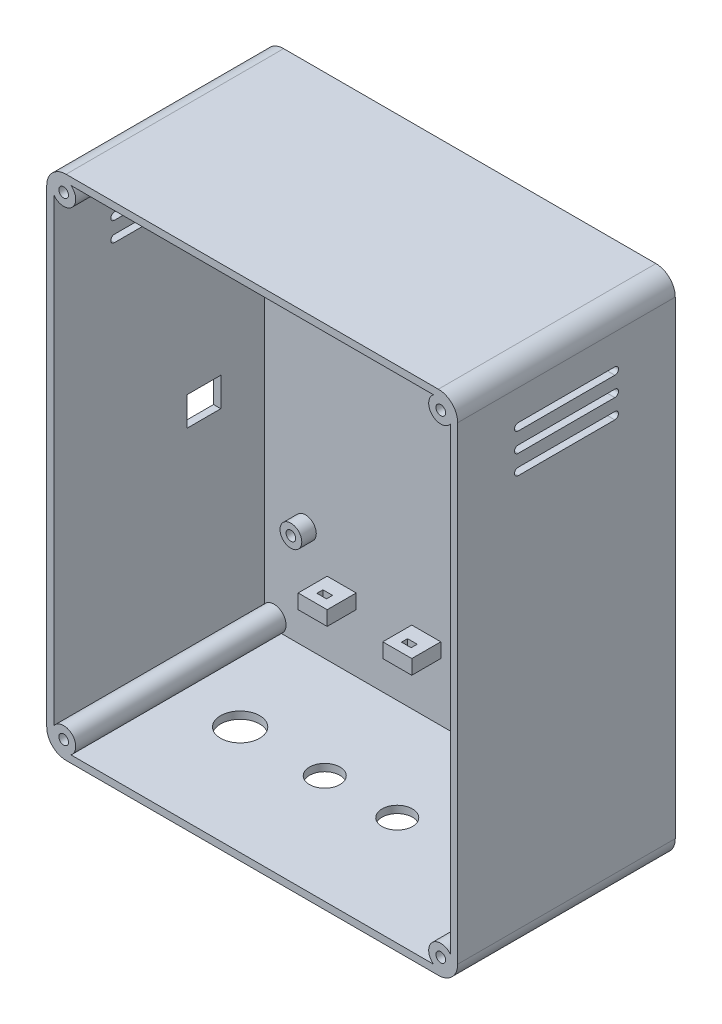
from build123d import *

# Parameters (mm, degrees)
BLOCK_DEPTH                    = 90
SHELL1_T                       = -3
SKETCH2_R                      = 5
CORNER_COLUMNS_DEPTH           = 90
SKETCH3_R                      = 2
FRONT_PANEL_INSERT_HOLES_DEPTH = 7
SKETCH4_R                      = 4.5
PLATE_BOSSES_DEPTH             = 6
SKETCH5_R                      = 2
PLATE_INSERT_HOLES_DEPTH       = 7
SKETCH6_R                      = 8.1
SKETCH6_R_2                    = 6.3
CABLE_GLAND_HOLES_DEPTH        = 4
SKETCH7_W                      = 12
SKETCH7_H                      = 6
CABLE_TIE_BARS_DEPTH           = 12
SKETCH8_W                      = 4
SKETCH8_H                      = 2.5
CABLE_TIE_SLOTS_DEPTH          = 6.02
SKETCH9_W                      = 14
SKETCH9_H                      = 12
USB_ACCESS_DEPTH               = 4
VENTS_LEFT_DEPTH               = 4
VENTS_START                    = -4
VENTS_RIGHT_DEPTH              = 4
SKETCH12_R                     = 4.75
KEYHOLE_HEADS_DEPTH            = 4
KEYHOLE_SLOTS_DEPTH            = 4


with BuildPart() as part:
    # Sketch1 → Block (new body)
    with BuildSketch(Plane.XY):
        with BuildLine():
            Line((-77, 0), (77, 0))
            ThreePointArc((77, 0), (82.656854249, 2.343145751), (85, 8))
            Line((85, 8), (85, 202))
            ThreePointArc((85, 202), (82.656854249, 207.656854249), (77, 210))
            Line((77, 210), (-77, 210))
            ThreePointArc((-77, 210), (-82.656854249, 207.656854249), (-85, 202))
            Line((-85, 202), (-85, 8))
            ThreePointArc((-85, 8), (-82.656854249, 2.343145751), (-77, 0))
        make_face()
    extrude(amount=BLOCK_DEPTH)

    # Shell1
    shell1_openings = [part.faces().sort_by_distance(p)[0] for p in [
        (0, 105, 90),
    ]]
    offset(amount=SHELL1_T, openings=shell1_openings, kind=Kind.INTERSECTION)

    # Sketch2 → Corner columns (add)
    with BuildSketch(Plane.XY):
        with Locations((-78, 7)):
            Circle(SKETCH2_R)
        with Locations((78, 7)):
            Circle(SKETCH2_R)
        with Locations((-78, 203)):
            Circle(SKETCH2_R)
        with Locations((78, 203)):
            Circle(SKETCH2_R)
    extrude(amount=CORNER_COLUMNS_DEPTH)

    # Sketch3 → Front panel insert holes (cut)
    with BuildSketch(Plane.XY.offset(90)):
        with Locations((-78, 7)):
            Circle(SKETCH3_R)
        with Locations((78, 7)):
            Circle(SKETCH3_R)
        with Locations((-78, 203)):
            Circle(SKETCH3_R)
        with Locations((78, 203)):
            Circle(SKETCH3_R)
    extrude(amount=-FRONT_PANEL_INSERT_HOLES_DEPTH, mode=Mode.SUBTRACT)

    # Sketch4 → Plate bosses (add)
    with BuildSketch(Plane.XY.offset(3)):
        with Locations((-65, 46)):
            Circle(SKETCH4_R)
        with Locations((65, 46)):
            Circle(SKETCH4_R)
        with Locations((-65, 190)):
            Circle(SKETCH4_R)
        with Locations((65, 190)):
            Circle(SKETCH4_R)
    extrude(amount=PLATE_BOSSES_DEPTH)

    # Sketch5 → Plate insert holes (cut)
    with BuildSketch(Plane.XY.offset(9)):
        with Locations((-65, 46)):
            Circle(SKETCH5_R)
        with Locations((65, 46)):
            Circle(SKETCH5_R)
        with Locations((-65, 190)):
            Circle(SKETCH5_R)
        with Locations((65, 190)):
            Circle(SKETCH5_R)
    extrude(amount=-PLATE_INSERT_HOLES_DEPTH, mode=Mode.SUBTRACT)

    # Sketch6 → Cable gland holes (cut)
    with BuildSketch(Plane(origin=(0, 0, 0), x_dir=(1, 0, 0), z_dir=(0, 1, 0))):
        with Locations((-50, -45)):
            Circle(SKETCH6_R)
        with Locations((-15, -45)):
            Circle(SKETCH6_R_2)
        with Locations((15, -45)):
            Circle(SKETCH6_R_2)
        with Locations((50, -45)):
            Circle(SKETCH6_R_2)
    extrude(amount=CABLE_GLAND_HOLES_DEPTH, mode=Mode.SUBTRACT)

    # Sketch7 → Cable tie bars (add)
    with BuildSketch(Plane.XY.offset(3)):
        with Locations((-50, 30)):
            Rectangle(SKETCH7_W, SKETCH7_H)
        with Locations((-15, 30)):
            Rectangle(SKETCH7_W, SKETCH7_H)
        with Locations((15, 30)):
            Rectangle(SKETCH7_W, SKETCH7_H)
        with Locations((50, 30)):
            Rectangle(SKETCH7_W, SKETCH7_H)
    extrude(amount=CABLE_TIE_BARS_DEPTH)

    # Sketch8 → Cable tie slots (cut)
    with BuildSketch(Plane(origin=(0, 26.99, 0), x_dir=(1, 0, 0), z_dir=(0, 1, 0))):
        with Locations((-50, -10)):
            Rectangle(SKETCH8_W, SKETCH8_H)
        with Locations((-15, -10)):
            Rectangle(SKETCH8_W, SKETCH8_H)
        with Locations((15, -10)):
            Rectangle(SKETCH8_W, SKETCH8_H)
        with Locations((50, -10)):
            Rectangle(SKETCH8_W, SKETCH8_H)
    extrude(amount=CABLE_TIE_SLOTS_DEPTH, mode=Mode.SUBTRACT)

    # Sketch9 → USB access (cut)
    with BuildSketch(Plane(origin=(-85, 0, 0), x_dir=(0, 0, -1), z_dir=(1, 0, 0))):
        with Locations((-28, 95)):
            Rectangle(SKETCH9_W, SKETCH9_H)
    extrude(amount=USB_ACCESS_DEPTH, mode=Mode.SUBTRACT)

    # Sketch10 → Vents left (cut)
    with BuildSketch(Plane(origin=(-85, 0, 0), x_dir=(0, 0, -1), z_dir=(1, 0, 0))):
        with BuildLine():
            Line((-25, 170.5), (-65, 170.5))
            ThreePointArc((-65, 170.5), (-66.5, 172), (-65, 173.5))
            Line((-65, 173.5), (-25, 173.5))
            ThreePointArc((-25, 173.5), (-23.5, 172), (-25, 170.5))
        make_face()
        with BuildLine():
            Line((-25, 178.5), (-65, 178.5))
            ThreePointArc((-65, 178.5), (-66.5, 180), (-65, 181.5))
            Line((-65, 181.5), (-25, 181.5))
            ThreePointArc((-25, 181.5), (-23.5, 180), (-25, 178.5))
        make_face()
        with BuildLine():
            Line((-25, 186.5), (-65, 186.5))
            ThreePointArc((-65, 186.5), (-66.5, 188), (-65, 189.5))
            Line((-65, 189.5), (-25, 189.5))
            ThreePointArc((-25, 189.5), (-23.5, 188), (-25, 186.5))
        make_face()
    extrude(amount=VENTS_LEFT_DEPTH, mode=Mode.SUBTRACT)

    # Sketch11 → Vents right (cut)
    with BuildSketch(Plane(origin=(85, 0, 0), x_dir=(0, 0, -1), z_dir=(1, 0, 0)).offset(VENTS_START)):
        with BuildLine():
            Line((-25, 170.5), (-65, 170.5))
            ThreePointArc((-65, 170.5), (-66.5, 172), (-65, 173.5))
            Line((-65, 173.5), (-25, 173.5))
            ThreePointArc((-25, 173.5), (-23.5, 172), (-25, 170.5))
        make_face()
        with BuildLine():
            Line((-25, 178.5), (-65, 178.5))
            ThreePointArc((-65, 178.5), (-66.5, 180), (-65, 181.5))
            Line((-65, 181.5), (-25, 181.5))
            ThreePointArc((-25, 181.5), (-23.5, 180), (-25, 178.5))
        make_face()
        with BuildLine():
            Line((-25, 186.5), (-65, 186.5))
            ThreePointArc((-65, 186.5), (-66.5, 188), (-65, 189.5))
            Line((-65, 189.5), (-25, 189.5))
            ThreePointArc((-25, 189.5), (-23.5, 188), (-25, 186.5))
        make_face()
    extrude(amount=VENTS_RIGHT_DEPTH, mode=Mode.SUBTRACT)

    # Sketch12 → Keyhole heads (cut)
    with BuildSketch(Plane.XY):
        with Locations((-45, 165)):
            Circle(SKETCH12_R)
        with Locations((45, 165)):
            Circle(SKETCH12_R)
    extrude(amount=KEYHOLE_HEADS_DEPTH, mode=Mode.SUBTRACT)

    # Sketch13 → Keyhole slots (cut)
    with BuildSketch(Plane.XY):
        with BuildLine():
            Line((-47.4, 165), (-47.4, 176))
            ThreePointArc((-47.4, 176), (-45, 178.4), (-42.6, 176))
            Line((-42.6, 176), (-42.6, 165))
            ThreePointArc((-42.6, 165), (-45, 162.6), (-47.4, 165))
        make_face()
        with BuildLine():
            Line((42.6, 165), (42.6, 176))
            ThreePointArc((42.6, 176), (45, 178.4), (47.4, 176))
            Line((47.4, 176), (47.4, 165))
            ThreePointArc((47.4, 165), (45, 162.6), (42.6, 165))
        make_face()
    extrude(amount=KEYHOLE_SLOTS_DEPTH, mode=Mode.SUBTRACT)


solid = part.part
